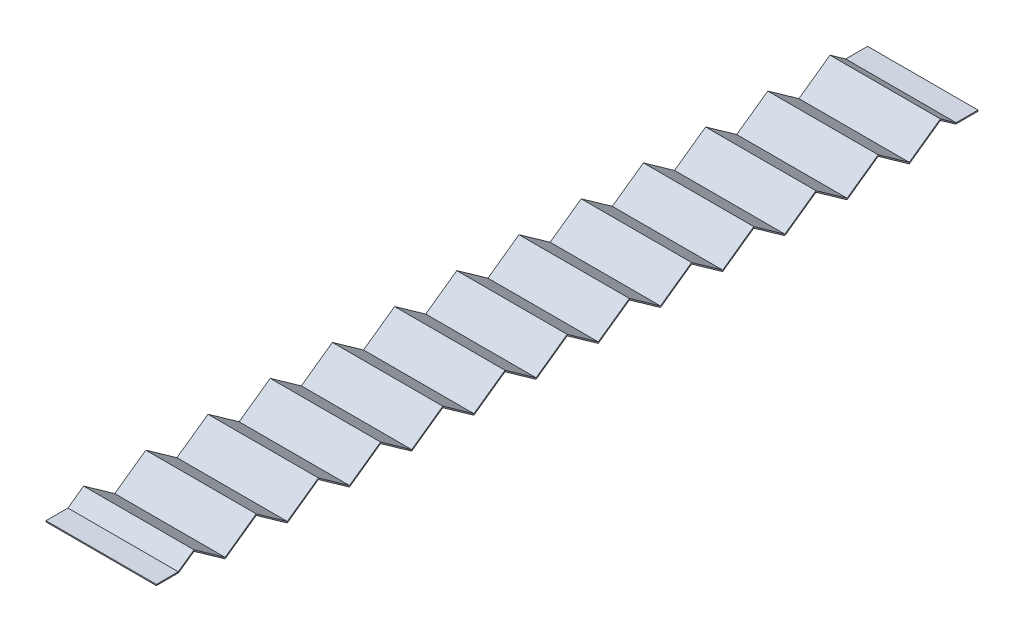
from build123d import *

# Parameters (mm, degrees)
EXTRUDE_THIN1_DEPTH = 25


with BuildPart() as part:
    # Sketch3 → Extrude-Thin1 (new, symmetric)
    with BuildSketch(Plane(origin=(0, 0, 0), x_dir=(0, 0, -1), z_dir=(1, 0, 0))):
        Polygon((0, 4.75), (10.079716888, 4.75), (17.043077004, 9.693407627), (31.129231011, -0.306592373), (45.215385018, 9.693407627), (59.301539025, -0.306592373), (73.387693032, 9.693407627), (87.473847039, -0.306592373), (101.560001046, 9.693407627), (115.646155053, -0.306592373), (129.73230906, 9.693407627), (143.818463067, -0.306592373), (157.904617074, 9.693407627), (171.990771081, -0.306592373), (186.076925088, 9.693407627), (200.163079095, -0.306592373), (214.249233102, 9.693407627), (228.335387109, -0.306592373), (242.421541116, 9.693407627), (256.507695123, -0.306592373), (270.59384913, 9.693407627), (284.680003138, -0.306592373), (298.766157145, 9.693407627), (312.852311152, -0.306592373), (326.938465159, 9.693407627), (341.024619166, -0.306592373), (355.110773173, 9.693407627), (362.074133289, 4.75), (372.153850176, 4.75), (372.153850176, 5.25), (362.233567064, 5.25), (355.110773173, 10.306592373), (341.024619166, 0.306592373), (326.938465159, 10.306592373), (312.852311152, 0.306592373), (298.766157145, 10.306592373), (284.680003138, 0.306592373), (270.59384913, 10.306592373), (256.507695123, 0.306592373), (242.421541116, 10.306592373), (228.335387109, 0.306592373), (214.249233102, 10.306592373), (200.163079095, 0.306592373), (186.076925088, 10.306592373), (171.990771081, 0.306592373), (157.904617074, 10.306592373), (143.818463067, 0.306592373), (129.73230906, 10.306592373), (115.646155053, 0.306592373), (101.560001046, 10.306592373), (87.473847039, 0.306592373), (73.387693032, 10.306592373), (59.301539025, 0.306592373), (45.215385018, 10.306592373), (31.129231011, 0.306592373), (17.043077004, 10.306592373), (9.920283112, 5.25), (0, 5.25), align=None)
    extrude(amount=EXTRUDE_THIN1_DEPTH, both=True)


solid = part.part
